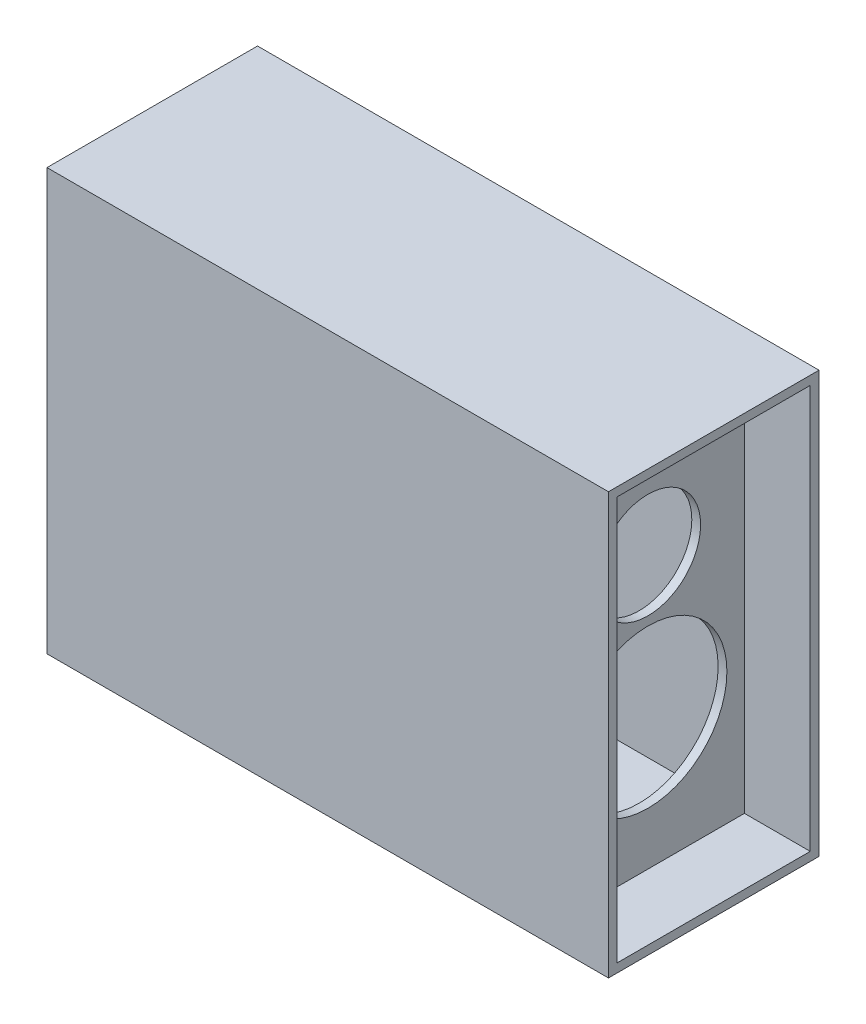
from build123d import *

# Parameters (mm, degrees)
SKETCH2_W                      = 152.4
SKETCH2_H                      = 76.2
BOSS_EXTRUDE1_DEPTH            = 3.175
SKETCH3_W                      = 152.4
SKETCH3_H                      = 76.2
SKETCH3_W_2                    = 146.05
SKETCH3_H_2                    = 69.85
BOSS_EXTRUDE2_DEPTH            = 71.4375
SKETCH4_W                      = 152.4
SKETCH4_H                      = 76.2
BOSS_EXTRUDE3_DEPTH            = 3.175
SKETCH5_W                      = 152.4
SKETCH5_H                      = 76.2
SKETCH5_W_2                    = 146.05
SKETCH5_H_2                    = 69.85
BOSS_EXTRUDE4_DEPTH            = 98.425
F_97_1_DIAMETER_HOLE1_D        = 25.4
F_97_1_5_DIAMETER_HOLE1_D      = 38.1
F_97_1_5_DIAMETER_HOLE1_DEPTH  = 6.35
SKETCH6_W                      = 152.4
SKETCH6_H                      = 76.2
BOSS_EXTRUDE6_DEPTH            = 3.175
F_97_1_5_DIAMETER_HOLE2_D      = 38.1
F_97_1_5_DIAMETER_HOLE2_DEPTH  = 6.35
F_97_2_25_DIAMETER_HOLE1_D     = 57.15
F_97_2_25_DIAMETER_HOLE1_DEPTH = 6.35
SKETCH16_W                     = 152.4
SKETCH16_H                     = 76.2
SKETCH16_W_2                   = 146.05
SKETCH16_H_2                   = 69.85
BOSS_EXTRUDE7_DEPTH            = 23.8125


with BuildPart() as part:
    # Sketch2 → Boss-Extrude1 (new body)
    with BuildSketch(Plane.YZ):
        with Locations((5.965836299, -2.847330961)):
            Rectangle(SKETCH2_W, SKETCH2_H)
    extrude(amount=BOSS_EXTRUDE1_DEPTH)

    # Sketch3 → Boss-Extrude2 (add)
    with BuildSketch(Plane.YZ.offset(3.175)):
        with Locations((5.965836299, -2.847330961)):
            Rectangle(SKETCH3_W, SKETCH3_H)
        with Locations((5.965836299, -2.847330961)):
            Rectangle(SKETCH3_W_2, SKETCH3_H_2, mode=Mode.SUBTRACT)
    extrude(amount=BOSS_EXTRUDE2_DEPTH)

    # Sketch4 → Boss-Extrude3 (add)
    with BuildSketch(Plane.YZ.offset(74.6125)):
        with Locations((5.965836299, -2.847330961)):
            Rectangle(SKETCH4_W, SKETCH4_H)
    extrude(amount=BOSS_EXTRUDE3_DEPTH)

    # Sketch5 → Boss-Extrude4 (add)
    with BuildSketch(Plane.YZ.offset(77.7875)):
        with Locations((5.965836299, -2.847330961)):
            Rectangle(SKETCH5_W, SKETCH5_H)
        with Locations((5.965836299, -2.847330961)):
            Rectangle(SKETCH5_W_2, SKETCH5_H_2, mode=Mode.SUBTRACT)
    extrude(amount=BOSS_EXTRUDE4_DEPTH)

    # #97 (1) Diameter Hole1 (through all)
    with Locations(Plane.YZ.offset(77.7875)):
        with Locations((-19.434163701, -2.847330961), (31.365836299, -2.847330961)):
            Hole(F_97_1_DIAMETER_HOLE1_D / 2)

    # #97 (1.5) Diameter Hole1
    with Locations(Plane(origin=(0, 0, 0), x_dir=(0, -1, 0), z_dir=(-1, 0, 0))):
        with Locations((-31.365836299, -2.847330961)):
            Hole(F_97_1_5_DIAMETER_HOLE1_D / 2, depth=F_97_1_5_DIAMETER_HOLE1_DEPTH)

    # Sketch6 → Boss-Extrude6 (add)
    with BuildSketch(Plane.YZ.offset(176.2125)):
        with Locations((5.965836299, -2.847330961)):
            Rectangle(SKETCH6_W, SKETCH6_H)
    extrude(amount=BOSS_EXTRUDE6_DEPTH)

    # #97 (1.5) Diameter Hole2
    with Locations(Plane.YZ.offset(179.3875)):
        with Locations((31.365836299, -2.847330961)):
            Hole(F_97_1_5_DIAMETER_HOLE2_D / 2, depth=F_97_1_5_DIAMETER_HOLE2_DEPTH)

    # #97 (2.25) Diameter Hole1
    with Locations(Plane.YZ.offset(179.3875)):
        with Locations((-19.434163701, -2.847330961)):
            Hole(F_97_2_25_DIAMETER_HOLE1_D / 2, depth=F_97_2_25_DIAMETER_HOLE1_DEPTH)

    # Sketch16 → Boss-Extrude7 (add)
    with BuildSketch(Plane.YZ.offset(179.3875)):
        with Locations((5.965836299, -2.847330961)):
            Rectangle(SKETCH16_W, SKETCH16_H)
        with Locations((5.965836299, -2.847330961)):
            Rectangle(SKETCH16_W_2, SKETCH16_H_2, mode=Mode.SUBTRACT)
    extrude(amount=BOSS_EXTRUDE7_DEPTH)


solid = part.part
